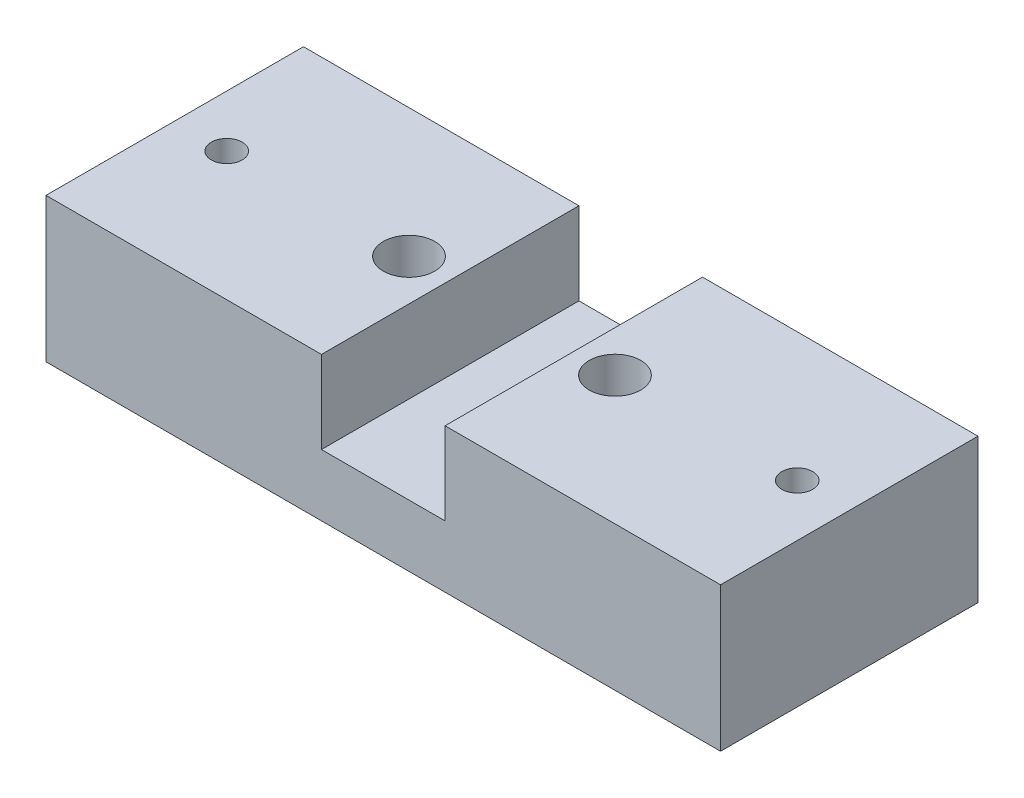
from build123d import *

# Parameters (mm, degrees)
BOSS_EXTRUDE1_DEPTH   = 25
F_3_0MM_DOWEL_HOLE1_D = 3
SKETCH5_R             = 5
CUT_EXTRUDE1_DEPTH    = 4
F_5_0MM_DOWEL_HOLE1_D = 5


with BuildPart() as part:
    # Sketch1 → Boss-Extrude1 (new body)
    with BuildSketch(Plane.XY):
        Polygon((26.75, 14), (26.75, 6), (38.75, 6), (38.75, 14), (65.5, 14), (65.5, 0), (0, 0), (0, 14), align=None)
    extrude(amount=BOSS_EXTRUDE1_DEPTH)

    # Ø3.0mm Dowel Hole1 (through all)
    with Locations(Plane(origin=(0, 14, 0), x_dir=(1, 0, 0), z_dir=(0, 1, 0))):
        with Locations((5.05, -12.5), (60.45, -12.5)):
            Hole(F_3_0MM_DOWEL_HOLE1_D / 2)

    # Sketch5 → Cut-Extrude1 (cut)
    with BuildSketch(Plane(origin=(0, 0, 0), x_dir=(1, 0, 0), z_dir=(0, 1, 0))):
        with Locations((50.65, -13)):
            Circle(SKETCH5_R)
        with Locations((14.45, -13)):
            Circle(SKETCH5_R)
    extrude(amount=CUT_EXTRUDE1_DEPTH, mode=Mode.SUBTRACT)

    # Ø5.0mm Dowel Hole1 (through all)
    with Locations(Plane(origin=(0, 14, 0), x_dir=(1, 0, 0), z_dir=(0, 1, 0))):
        with Locations((42.75, -12.5), (22.75, -12.5)):
            Hole(F_5_0MM_DOWEL_HOLE1_D / 2)


solid = part.part
